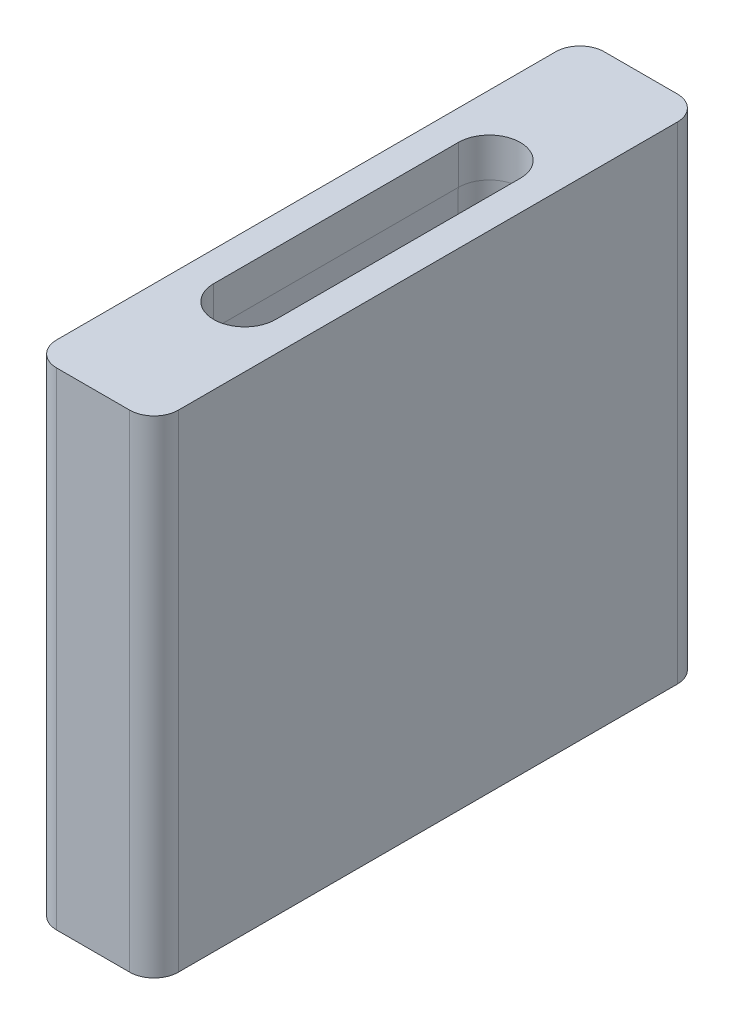
from build123d import *

# Parameters (mm, degrees)
BOSS_EXTRUDE1_DEPTH         = 40
CUT_EXTRUDE2_REACH          = 48.165
M6_TAPPED_HOLE1_D           = 5
M6_TAPPED_HOLE1_DEPTH       = 17
M6_TAPPED_HOLE1_CSINK_D     = 6.05
M6_TAPPED_HOLE1_CSINK_ANGLE = 90
M6_TAPPED_HOLE1_TIP         = 1.502151548


with BuildPart() as part:
    # Sketch1 → Boss-Extrude1 (new body)
    with BuildSketch(Plane(origin=(0, 0, 0), x_dir=(1, 0, 0), z_dir=(0, 1, 0))):
        with BuildLine():
            Line((-3, -22.5), (3, -22.5))
            ThreePointArc((3, -22.5), (4.414213562, -21.914213562), (5, -20.5))
            Line((5, -20.5), (5, 20.5))
            ThreePointArc((5, 20.5), (4.414213562, 21.914213562), (3, 22.5))
            Line((3, 22.5), (-3, 22.5))
            ThreePointArc((-3, 22.5), (-4.414213562, 21.914213562), (-5, 20.5))
            Line((-5, 20.5), (-5, -20.5))
            ThreePointArc((-5, -20.5), (-4.414213562, -21.914213562), (-3, -22.5))
        make_face()
    extrude(amount=-BOSS_EXTRUDE1_DEPTH)

    # Sketch5 → Cut-Extrude2 (cut, up to next)
    with BuildSketch(Plane(origin=(0, 0, 0), x_dir=(1, 0, 0), z_dir=(0, 1, 0)), mode=Mode.PRIVATE) as cut_extrude2_sk1:
        with BuildLine():
            Line((-2.55, -10.05), (-2.55, 10.05))
            ThreePointArc((-2.55, 10.05), (0, 12.6), (2.55, 10.05))
            Line((2.55, 10.05), (2.55, -10.05))
            ThreePointArc((2.55, -10.05), (0, -12.6), (-2.55, -10.05))
        make_face()
    cut_extrude2_tool1 = extrude(cut_extrude2_sk1.sketch, amount=-CUT_EXTRUDE2_REACH, mode=Mode.PRIVATE) & part.part
    add(cut_extrude2_tool1.solids().sort_by_distance((0, 0, 0))[0], mode=Mode.SUBTRACT)

    # Cut-Sweep1: sweep along a path in Sketch8
    with BuildLine(Plane(origin=(0, 0, 0), x_dir=(1, 0, 0), z_dir=(0, 1, 0))) as cut_sweep1_path:
        Line((-2.55, 10.05), (-2.55, -10.05))
        ThreePointArc((-2.55, -10.05), (0, -12.6), (2.55, -10.05))
        Line((2.55, -10.05), (2.55, 10.05))
        ThreePointArc((2.55, 10.05), (0, 12.6), (-2.55, 10.05))
    # Sketch7 → Cut-Sweep1 (sweep, cut)
    with BuildSketch(Plane.XY):
        Polygon((2.55, -3.2), (3.192346389, -40), (2.55, -40), align=None)
    sweep(path=cut_sweep1_path.line, mode=Mode.SUBTRACT)

    # M6 Tapped Hole1
    with Locations(Plane(origin=(0, -40, 0), x_dir=(-1, 0, 0), z_dir=(0, -1, 0))):
        with Locations((0, 17.5), (0, -17.5)):
            CounterSinkHole(M6_TAPPED_HOLE1_D / 2, M6_TAPPED_HOLE1_CSINK_D / 2, depth=M6_TAPPED_HOLE1_DEPTH, counter_sink_angle=M6_TAPPED_HOLE1_CSINK_ANGLE)
            with Locations((0, 0, -(M6_TAPPED_HOLE1_DEPTH + M6_TAPPED_HOLE1_TIP / 2))):  # 118° drill point
                Cone(0, M6_TAPPED_HOLE1_D / 2, M6_TAPPED_HOLE1_TIP, mode=Mode.SUBTRACT)


solid = part.part
